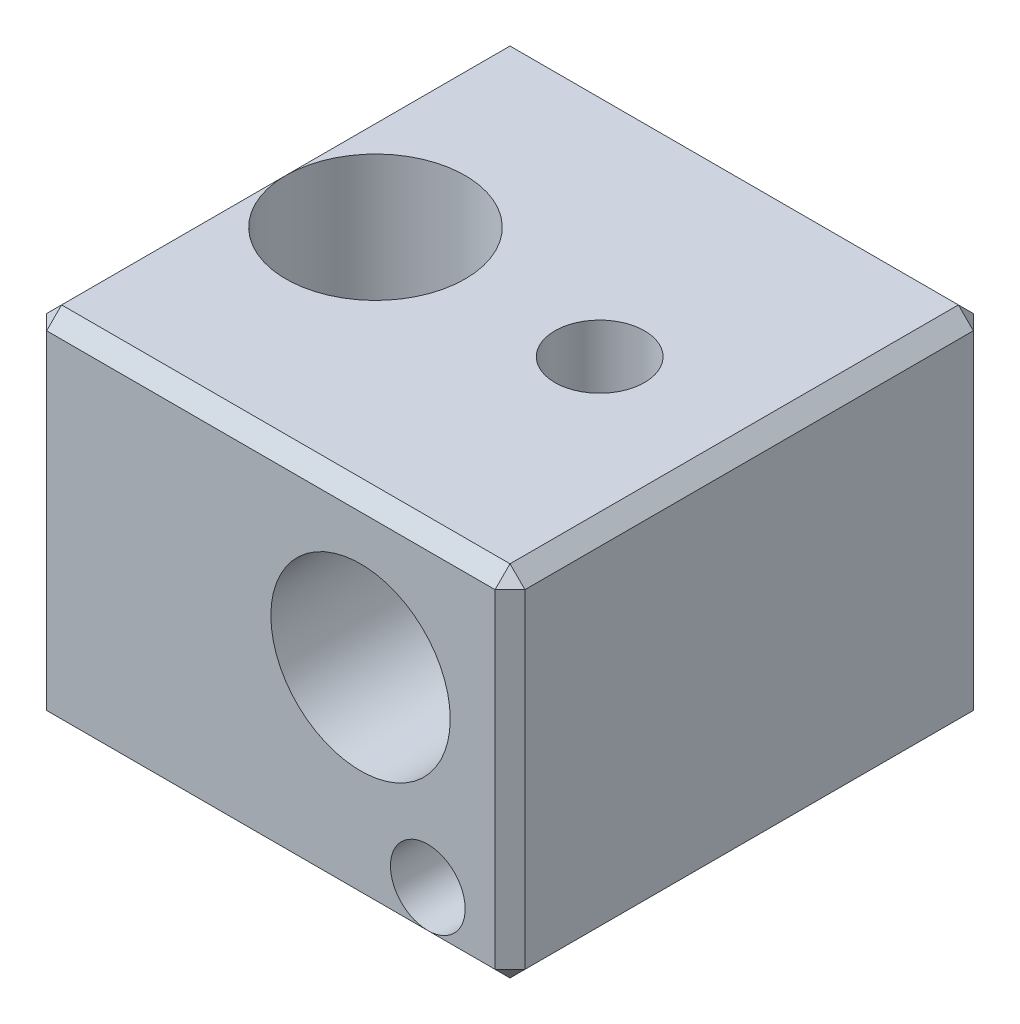
from build123d import *

# Parameters (mm, degrees)
SKETCH_1_W               = 16
SKETCH_1_H               = 16
EXTRUDE_1_DEPTH          = 12
SKETCH_2_R               = 3
CUT_EXTRUDE_2_DEPTH      = 17.492422502
SKETCH_3_R               = 1.25
CUT_EXTRUDE_3_DEPTH      = 22.540659229
SKETCH_4_R               = 3
CUT_EXTRUDE_4_DEPTH      = 22.540659229
CHAMFER_1_SIZE           = 0.5
CUT_EXTRUDE_5_REACH      = 18.492
CUT_EXTRUDE_5_END_RADIUS = 3
SKETCH_5_R               = 1.5


with BuildPart() as part:
    # 草圖1 → 填料-伸長1 (new body)
    with BuildSketch(Plane(origin=(0, 0, 0), x_dir=(1, 0, 0), z_dir=(0, 1, 0))):
        Rectangle(SKETCH_1_W, SKETCH_1_H)
    extrude(amount=EXTRUDE_1_DEPTH)

    # 草圖2 → 除料-伸長2 (cut, through all)
    with BuildSketch(Plane(origin=(0, 12, 0), x_dir=(1, 0, 0), z_dir=(0, 1, 0))):
        with Locations(Location((-4.5, 0, 0), (0, 0, 270))):
            Circle(SKETCH_2_R)
    extrude(amount=-CUT_EXTRUDE_2_DEPTH, mode=Mode.SUBTRACT)

    # 草圖3 → 除料-伸長3 (cut, through all)
    with BuildSketch(Plane.XY.offset(8)):
        with Locations((5.25, 1.75)):
            Circle(SKETCH_3_R)
    extrude(amount=-CUT_EXTRUDE_3_DEPTH, mode=Mode.SUBTRACT)

    # 草圖4 → 除料-伸長4 (cut, through all)
    with BuildSketch(Plane.XY.offset(8)):
        with Locations((3, 7)):
            Circle(SKETCH_4_R)
    extrude(amount=-CUT_EXTRUDE_4_DEPTH, mode=Mode.SUBTRACT)

    # 導角1
    chamfer_1_edges = [part.edges().sort_by_distance(p)[0] for p in [
        (8, 12, 0),
        (0, 12, -8),
        (-8, 12, 0),
        (0, 0, -8),
        (8, 0, 0),
        (0, 0, 8),
        (-8, 0, 0),
        (0, 12, 8),
        (-8, 6, -8),
        (8, 6, -8),
        (8, 6, 8),
        (-8, 6, 8),
    ]]
    chamfer(chamfer_1_edges, length=CHAMFER_1_SIZE - 0.0001)  # a hair under: the kernel refuses the full size

    # 除料-伸長5: up to this cylinder (the profile starts outside it)
    cut_extrude_5_end = Plane(origin=(3, 7, 0), z_dir=(0, 0, 1)) * Cylinder(CUT_EXTRUDE_5_END_RADIUS, 43.984, mode=Mode.PRIVATE)
    # 草圖5 → 除料-伸長5 (cut, up to the surface)
    with BuildSketch(Plane(origin=(0, 12, 0), x_dir=(1, 0, 0), z_dir=(0, 1, 0)), mode=Mode.PRIVATE) as cut_extrude_5_sk1:
        with Locations(Location((3, 0, 0), (0, 0, 270))):
            Circle(SKETCH_5_R)
    cut_extrude_5_tool1 = extrude(cut_extrude_5_sk1.sketch, amount=-CUT_EXTRUDE_5_REACH, mode=Mode.PRIVATE) - cut_extrude_5_end
    add(cut_extrude_5_tool1.solids().sort_by_distance((3, 12, 0))[0], mode=Mode.SUBTRACT)


solid = part.part
